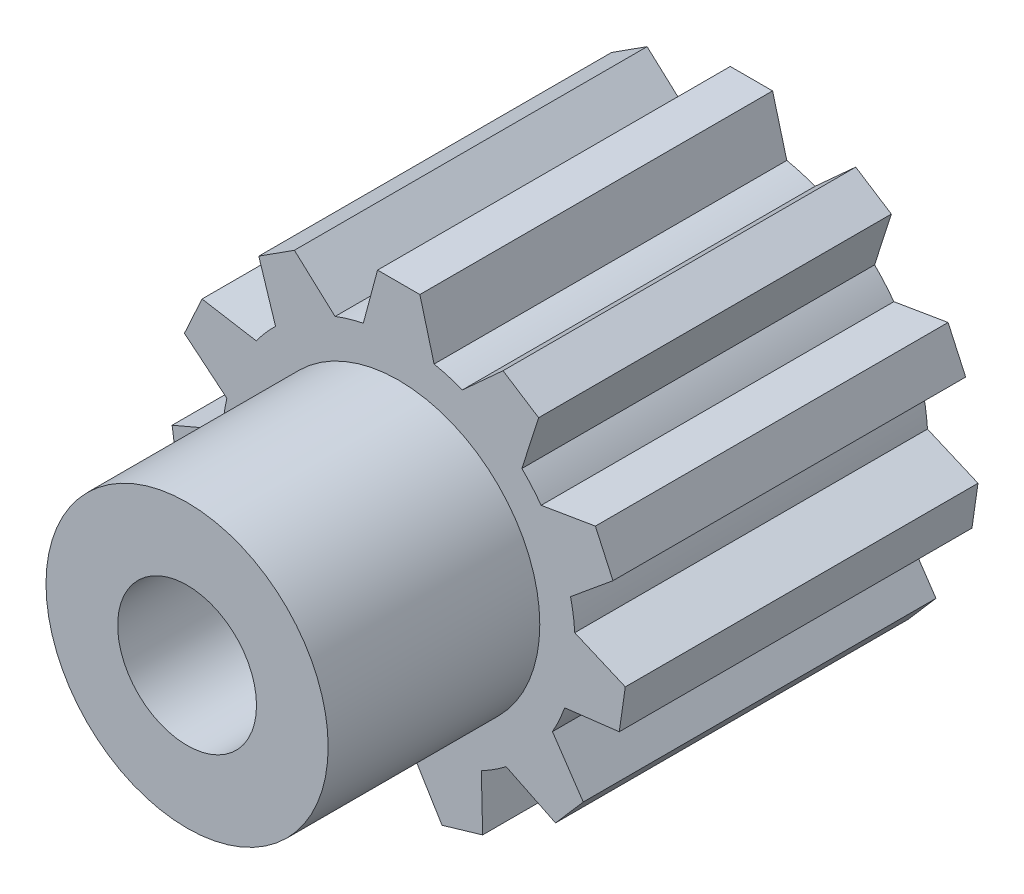
from build123d import *

# Parameters (mm, degrees)
SKETCH1_R           = 6.35
BOSS_EXTRUDE1_DEPTH = 12.7
BOSS_EXTRUDE2_DEPTH = 12.7
CIRPATTERN1_COUNT   = 11
SKETCH3_R           = 5.08
BOSS_EXTRUDE3_DEPTH = 7.62
SKETCH4_R           = 2.5
CUT_EXTRUDE1_DEPTH  = 24.358474096


with BuildPart() as part:
    # Sketch1 → Boss-Extrude1 (new body)
    with BuildSketch(Plane.XY):
        Circle(SKETCH1_R)
    extrude(amount=BOSS_EXTRUDE1_DEPTH)

    # Sketch2 → Boss-Extrude2 (add)
    with BuildSketch(Plane.XY.offset(12.7)):
        Polygon((0, 8.13319935), (-0.762, 8.13319935), (-1.388433627, 5.795317226), (1.388433627, 5.795317226), (0.762, 8.13319935), align=None)
    boss_extrude2 = extrude(amount=-BOSS_EXTRUDE2_DEPTH)

    # CirPattern1: Boss-Extrude2 ×11 about axis
    cirpattern1_axis = Axis((0, 0, 12.7), (0, 0, -1))
    for i in range(1, CIRPATTERN1_COUNT):
        add(boss_extrude2.rotate(cirpattern1_axis, i * 360 / CIRPATTERN1_COUNT))

    # Sketch3 → Boss-Extrude3 (add)
    with BuildSketch(Plane.XY.offset(12.7)):
        Circle(SKETCH3_R)
    extrude(amount=BOSS_EXTRUDE3_DEPTH)

    # Sketch4 → Cut-Extrude1 (cut, through all)
    with BuildSketch(Plane.XY.offset(20.32)):
        Circle(SKETCH4_R)
    extrude(amount=-CUT_EXTRUDE1_DEPTH, mode=Mode.SUBTRACT)


solid = part.part
